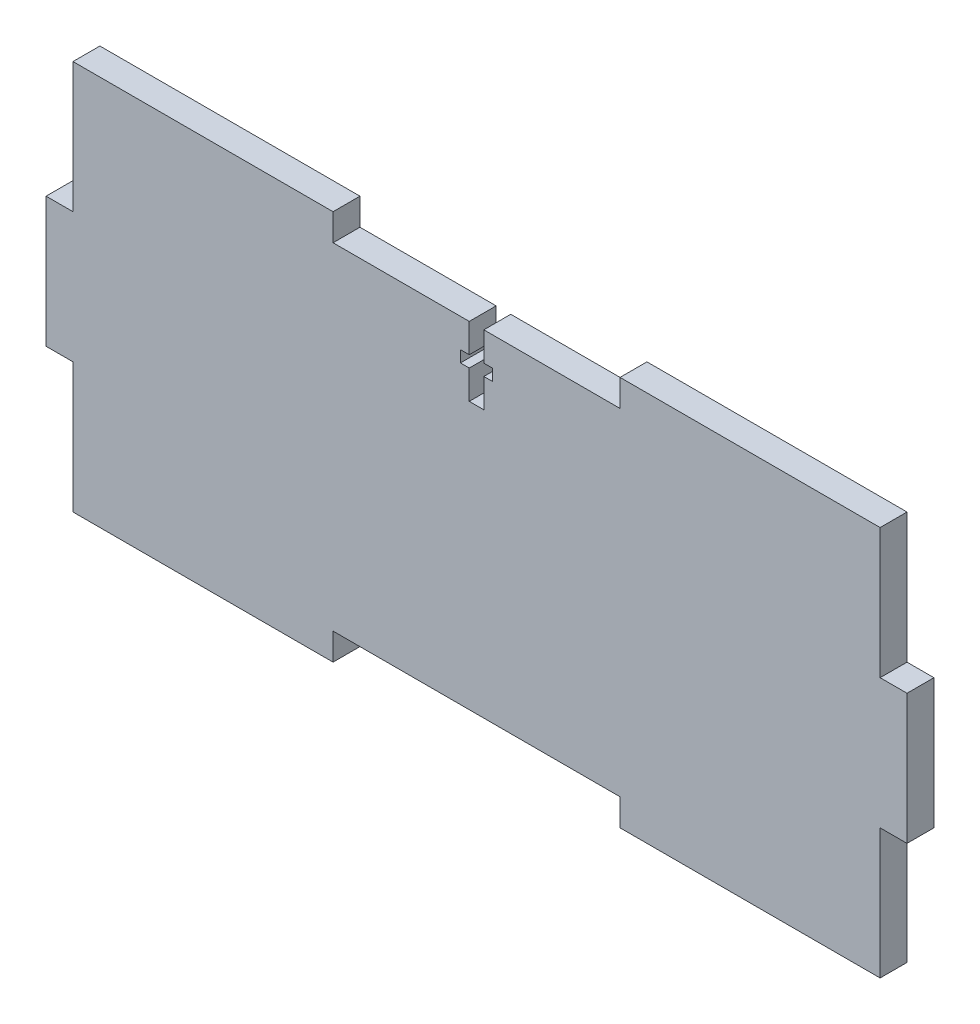
from build123d import *

# Parameters (mm, degrees)
SKETCH1_W           = 162.56
SKETCH1_H           = 73.66
BOSS_EXTRUDE1_DEPTH = 5.08
SKETCH2_W           = 54.186666666
SKETCH2_H           = 5.08
CUT_EXTRUDE1_DEPTH  = 90.379492614
SKETCH5_W           = 2.7559
SKETCH5_H           = 13.081
CUT_EXTRUDE4_DEPTH  = 90.379492614
SKETCH6_W           = 6.096
SKETCH6_H           = 2.1717
CUT_EXTRUDE5_DEPTH  = 90.379492614
CAVITY1_START       = -36.83
CAVITY1_OUTLINE_W   = 5.08
CAVITY1_OUTLINE_H   = 5.08
CAVITY1_DEPTH       = 24.553333333
CAVITY1_START_2     = 12.276666667
CAVITY1_2_OUTLINE_W = 5.08
CAVITY1_2_OUTLINE_H = 5.08
CAVITY1_2_DEPTH     = 24.553333333


# Read off the part's stored shape, not the designer's step: Cavity1
with BuildPart() as part:
    # Sketch1 → Boss-Extrude1 (new body)
    with BuildSketch(Plane.XY):
        Rectangle(SKETCH1_W, SKETCH1_H)
    extrude(amount=BOSS_EXTRUDE1_DEPTH)

    # Sketch2 → Cut-Extrude1 (cut, through all)
    with BuildSketch(Plane.XY.offset(5.08)):
        with Locations((0, -34.29)):
            Rectangle(SKETCH2_W, SKETCH2_H)
        with Locations((0, 34.29)):
            Rectangle(SKETCH2_W, SKETCH2_H)
    extrude(amount=-CUT_EXTRUDE1_DEPTH, mode=Mode.SUBTRACT)

    # Sketch5 → Cut-Extrude4 (cut, through all)
    with BuildSketch(Plane.XY.offset(5.08)):
        with Locations((0, 25.2095)):
            Rectangle(SKETCH5_W, SKETCH5_H)
    extrude(amount=-CUT_EXTRUDE4_DEPTH, mode=Mode.SUBTRACT)

    # Sketch6 → Cut-Extrude5 (cut, through all)
    with BuildSketch(Plane.XY.offset(5.08)):
        with Locations((0, 25.2095)):
            Rectangle(SKETCH6_W, SKETCH6_H)
    extrude(amount=-CUT_EXTRUDE5_DEPTH, mode=Mode.SUBTRACT)

    # Cavity1 outline → Cavity1 (cut)
    with BuildSketch(Plane(origin=(0, 0, 0), x_dir=(1, 0, 0), z_dir=(0, 1, 0)).offset(CAVITY1_START)):
        with Locations((78.74, -2.54)):
            Rectangle(CAVITY1_OUTLINE_W, CAVITY1_OUTLINE_H)
        with Locations((-78.74, -2.54)):
            Rectangle(CAVITY1_OUTLINE_W, CAVITY1_OUTLINE_H)
    extrude(amount=CAVITY1_DEPTH, mode=Mode.SUBTRACT)

    # Cavity1 2 outline → Cavity1 2 (cut)
    with BuildSketch(Plane(origin=(0, 0, 0), x_dir=(1, 0, 0), z_dir=(0, 1, 0)).offset(CAVITY1_START_2)):
        with Locations((78.74, -2.54)):
            Rectangle(CAVITY1_2_OUTLINE_W, CAVITY1_2_OUTLINE_H)
        with Locations((-78.74, -2.54)):
            Rectangle(CAVITY1_2_OUTLINE_W, CAVITY1_2_OUTLINE_H)
    extrude(amount=CAVITY1_2_DEPTH, mode=Mode.SUBTRACT)


solid = part.part
